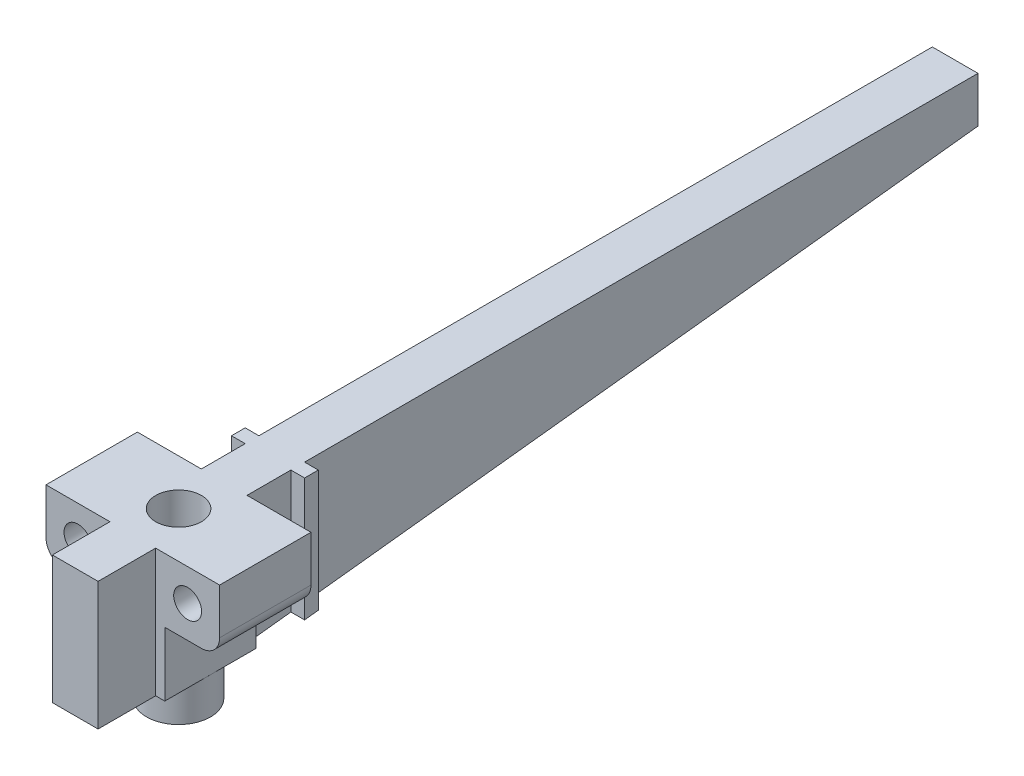
from build123d import *

# Parameters (mm, degrees)
SKETCH_1_R           = 1.525
EXTRUDE_1_DEPTH      = 10
EXTRUDE_2_DEPTH      = 2.5
EXTRUDE_2_DEPTH_BACK = 2.5
SKETCH_4_W           = 5
SKETCH_4_H           = 14
EXTRUDE_3_DEPTH      = 6.3
CUT_EXTRUDE_1_REACH  = 84.481
SKETCH_5_R           = 2.5
EXTRUDE_5_DEPTH      = 1.5
SKETCH_7_R           = 3.5
SKETCH_7_R_2         = 3.05
EXTRUDE_6_DEPTH      = 4


with BuildPart() as part:
    # 草图1 → 凸台-拉伸1 (new body)
    with BuildSketch(Plane.XY):
        with BuildLine():
            Line((-4.609526623, 6.301360946), (-4.609526623, 1.301360946))
            ThreePointArc((-4.609526623, 1.301360946), (-4.023740186, -0.112852616), (-2.609526623, -0.698639054))
            Line((-2.609526623, -0.698639054), (1.390473377, -0.698639054))
            Line((1.390473377, -0.698639054), (1.390473377, -7.698639054))
            Line((1.390473377, -7.698639054), (8.390473377, -7.698639054))
            Line((8.390473377, -7.698639054), (8.390473377, -0.698639054))
            Line((8.390473377, -0.698639054), (12.390473377, -0.698639054))
            ThreePointArc((12.390473377, -0.698639054), (13.804686939, -0.112852616), (14.390473377, 1.301360946))
            Line((14.390473377, 1.301360946), (14.390473377, 6.301360946))
            Line((14.390473377, 6.301360946), (-4.609526623, 6.301360946))
        make_face()
        with Locations((10.890473377, 2.801360946)):
            Circle(SKETCH_1_R, mode=Mode.SUBTRACT)
        with Locations((-1.109526623, 2.801360946)):
            Circle(SKETCH_1_R, mode=Mode.SUBTRACT)
    extrude(amount=EXTRUDE_1_DEPTH)

    # 草图3 → 凸台-拉伸2 (add, two sides: drawn at the far end of the back side and taken through both)
    with BuildSketch(Plane(origin=(4.890473377, 0, 0), x_dir=(0, 0, -1), z_dir=(1, 0, 0)).offset(-EXTRUDE_2_DEPTH_BACK)):
        Polygon((0, 6.301360946), (80, 6.301360946), (80, 1.301360946), (0, -7.698639054), align=None)
    extrude(amount=EXTRUDE_2_DEPTH + EXTRUDE_2_DEPTH_BACK)

    # 草图4 → 凸台-拉伸3 (add)
    with BuildSketch(Plane.XY.offset(10)):
        with Locations((4.890473377, -0.698639054)):
            Rectangle(SKETCH_4_W, SKETCH_4_H)
    extrude(amount=EXTRUDE_3_DEPTH)

    # 草图5 → 切除-拉伸1 (cut, up to next)
    with BuildSketch(Plane(origin=(0, 6.301360946, 0), x_dir=(1, 0, 0), z_dir=(0, 1, 0)), mode=Mode.PRIVATE) as cut_extrude_1_sk1:
        with Locations((4.900882763, -5)):
            Circle(SKETCH_5_R)
    cut_extrude_1_tool1 = extrude(cut_extrude_1_sk1.sketch, amount=-CUT_EXTRUDE_1_REACH, mode=Mode.PRIVATE) & part.part
    add(cut_extrude_1_tool1.solids().sort_by_distance((4.900883, 6.301361, 5))[0], mode=Mode.SUBTRACT)

    # 草图6 → 凸台-拉伸5 (add)
    with BuildSketch(Plane(origin=(7.390473377, 0, 0), x_dir=(0, 0, -1), z_dir=(1, 0, 0))):
        Polygon((6.3, 6.301360946), (4.8, 6.301360946), (4.8, -7.158639054), (6.3, -6.989889054), align=None)
    extrude_5 = extrude(amount=EXTRUDE_5_DEPTH)

    # 镜向1: 凸台-拉伸5 across plane
    add(extrude_5.mirror(Plane(origin=(4.890473377, 0, 0), x_dir=(0, 0, 1), z_dir=(1, 0, 0))))

    # 草图7 → 凸台-拉伸6 (add)
    with BuildSketch(Plane.XZ.offset(7.698639054)):
        with Locations((4.900882763, 5)):
            Circle(SKETCH_7_R)
        with Locations((4.900882763, 5)):
            Circle(SKETCH_7_R_2, mode=Mode.SUBTRACT)
    extrude(amount=EXTRUDE_6_DEPTH)


solid = part.part
